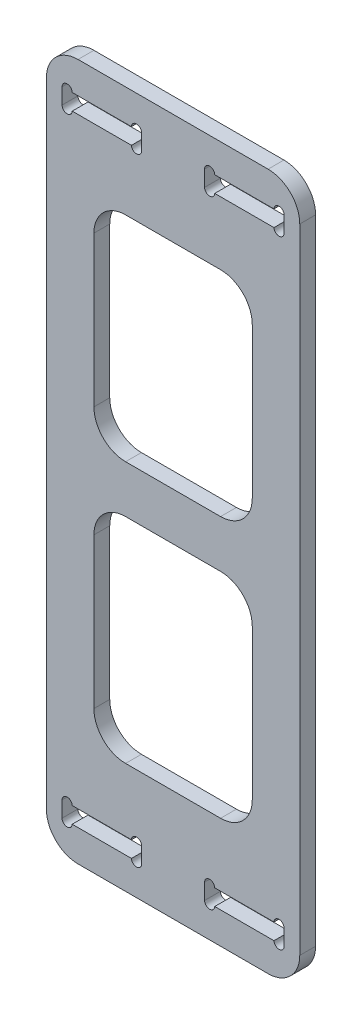
from build123d import *

# Parameters (mm, degrees)
SKETCH_1_W          = 25
SKETCH_1_H          = 5
SKETCH_1_W_2        = 70
SKETCH_1_H_2        = 190
EXTRUDE_1_DEPTH     = 5
SKETCH_3_W          = 50
SKETCH_3_H          = 67.5
CUT_EXTRUDE_2_DEPTH = 5
FILLET_1_R          = 10
CUT_EXTRUDE_3_DEPTH = 10
SKETCH_6_W          = 5
SKETCH_6_H          = 220
EXTRUDE_2_DEPTH     = 5
MOVE_FACE_1_DEPTH   = 5
FILLET_2_R          = 10


# Read off the part's stored shape, not the designer's step: 移动面1
with BuildPart() as part:
    # 草图1 → 凸台-拉伸1 (new body)
    with BuildSketch(Plane.XY):
        with Locations((57.5, 192.5)):
            Rectangle(SKETCH_1_W, SKETCH_1_H)
        with Locations((35, 95)):
            Rectangle(SKETCH_1_W_2, SKETCH_1_H_2)
        with Locations((12.5, 192.5)):
            Rectangle(SKETCH_1_W, SKETCH_1_H)
        with Locations((57.5, -2.5)):
            Rectangle(SKETCH_1_W, SKETCH_1_H)
        with Locations((12.5, -2.5)):
            Rectangle(SKETCH_1_W, SKETCH_1_H)
        Polygon((25, -5), (0, -5), (0, -15), (70, -15), (70, -5), (45, -5), (45, 0), (25, 0), align=None)
        Polygon((25, 195), (25, 190), (45, 190), (45, 195), (70, 195), (70, 205), (0, 205), (0, 195), align=None)
    extrude(amount=EXTRUDE_1_DEPTH)

    # 草图3 → 切除-拉伸2 (cut)
    with BuildSketch(Plane.XY.offset(5)):
        with Locations((35, 53.75)):
            Rectangle(SKETCH_3_W, SKETCH_3_H)
        with Locations((35, 136.25)):
            Rectangle(SKETCH_3_W, SKETCH_3_H)
    extrude(amount=-CUT_EXTRUDE_2_DEPTH, mode=Mode.SUBTRACT)

    # 圆角1
    fillet_1_edges = [part.edges().sort_by_distance(p)[0] for p in [
        (10, 20, 2.5),
        (10, 87.5, 2.5),
        (60, 87.5, 2.5),
        (60, 20, 2.5),
        (10, 102.5, 2.5),
        (10, 170, 2.5),
        (60, 170, 2.5),
        (60, 102.5, 2.5),
    ]]
    fillet(fillet_1_edges, radius=FILLET_1_R)

    # 草图5 → 切除-拉伸3 (cut)
    with BuildSketch(Plane.XY.offset(5)):
        with BuildLine():
            Line((3.1, 0), (21.9, 0))
            ThreePointArc((21.9, 0), (23.45, 1.55), (25, 0))
            Line((25, 0), (25, -5))
            ThreePointArc((25, -5), (23.45, -6.55), (21.9, -5))
            Line((21.9, -5), (3.1, -5))
            ThreePointArc((3.1, -5), (1.55, -6.55), (0, -5))
            Line((0, -5), (0, 0))
            ThreePointArc((0, 0), (1.55, 1.55), (3.1, 0))
        make_face()
        with BuildLine():
            Line((45, 0), (45, -5))
            ThreePointArc((45, -5), (46.55, -6.55), (48.1, -5))
            Line((48.1, -5), (66.9, -5))
            ThreePointArc((66.9, -5), (68.45, -6.55), (70, -5))
            Line((70, -5), (70, 0))
            ThreePointArc((70, 0), (68.45, 1.55), (66.9, 0))
            Line((66.9, 0), (48.1, 0))
            ThreePointArc((48.1, 0), (46.55, 1.55), (45, 0))
        make_face()
        with BuildLine():
            Line((66.9, 190), (48.1, 190))
            ThreePointArc((48.1, 190), (46.55, 188.45), (45, 190))
            Line((45, 190), (45, 195))
            ThreePointArc((45, 195), (46.55, 196.55), (48.1, 195))
            Line((48.1, 195), (66.9, 195))
            ThreePointArc((66.9, 195), (68.45, 196.55), (70, 195))
            Line((70, 195), (70, 190))
            ThreePointArc((70, 190), (68.45, 188.45), (66.9, 190))
        make_face()
        with BuildLine():
            Line((25, 190), (25, 195))
            ThreePointArc((25, 195), (23.45, 196.55), (21.9, 195))
            Line((21.9, 195), (3.1, 195))
            ThreePointArc((3.1, 195), (1.55, 196.55), (0, 195))
            Line((0, 195), (0, 190))
            ThreePointArc((0, 190), (1.55, 188.45), (3.1, 190))
            Line((3.1, 190), (21.9, 190))
            ThreePointArc((21.9, 190), (23.45, 188.45), (25, 190))
        make_face()
    extrude(amount=-CUT_EXTRUDE_3_DEPTH, mode=Mode.SUBTRACT)

    # 草图6 → 凸台-拉伸2 (add)
    with BuildSketch(Plane.XY.offset(5)):
        with Locations((72.5, 95)):
            Rectangle(SKETCH_6_W, SKETCH_6_H)
        with Locations((-2.5, 95)):
            Rectangle(SKETCH_6_W, SKETCH_6_H)
    extrude(amount=-EXTRUDE_2_DEPTH)

    # Move Face 1 outline → Move Face 1 (cut)
    # profile 1 of 4: a face of its own
    with BuildSketch(Plane.XY):
        with BuildLine():
            Line((21.850781441, 0.05), (3.149218559, 0.05))
            ThreePointArc((3.149218559, 0.05), (1.524996947, 1.599804628), (-0.05, 0))
            Line((-0.05, 0), (-0.05, -5))
            ThreePointArc((-0.05, -5), (1.524996947, -6.599804628), (3.149218559, -5.05))
            Line((3.149218559, -5.05), (21.850781441, -5.05))
            ThreePointArc((21.850781441, -5.05), (23.475003053, -6.599804628), (25.05, -5))
            Line((25.05, -5), (25.05, 0))
            ThreePointArc((25.05, 0), (23.475003053, 1.599804628), (21.850781441, 0.05))
        make_face()
        with BuildLine():
            ThreePointArc((0, 0), (1.55, 1.55), (3.1, 0))
            Line((3.1, 0), (21.9, 0))
            ThreePointArc((21.9, 0), (23.45, 1.55), (25, 0))
            Line((25, 0), (25, -5))
            ThreePointArc((25, -5), (23.45, -6.55), (21.9, -5))
            Line((21.9, -5), (3.1, -5))
            ThreePointArc((3.1, -5), (1.55, -6.55), (0, -5))
            Line((0, -5), (0, 0))
        make_face(mode=Mode.SUBTRACT)
    # profile 2 of 4: a face of its own
    with BuildSketch(Plane.XY):
        with BuildLine():
            ThreePointArc((70.05, 0), (68.475003053, 1.599804628), (66.850781441, 0.05))
            Line((66.850781441, 0.05), (48.149218559, 0.05))
            ThreePointArc((48.149218559, 0.05), (46.524996947, 1.599804628), (44.95, 0))
            Line((44.95, 0), (44.95, -5))
            ThreePointArc((44.95, -5), (46.524996947, -6.599804628), (48.149218559, -5.05))
            Line((48.149218559, -5.05), (66.850781441, -5.05))
            ThreePointArc((66.850781441, -5.05), (68.475003053, -6.599804628), (70.05, -5))
            Line((70.05, -5), (70.05, 0))
        make_face()
        with BuildLine():
            Line((48.1, 0), (66.9, 0))
            ThreePointArc((66.9, 0), (68.45, 1.55), (70, 0))
            Line((70, 0), (70, -5))
            ThreePointArc((70, -5), (68.45, -6.55), (66.9, -5))
            Line((66.9, -5), (48.1, -5))
            ThreePointArc((48.1, -5), (46.55, -6.55), (45, -5))
            Line((45, -5), (45, 0))
            ThreePointArc((45, 0), (46.55, 1.55), (48.1, 0))
        make_face(mode=Mode.SUBTRACT)
    # profile 3 of 4: a face of its own
    with BuildSketch(Plane.XY):
        with BuildLine():
            ThreePointArc((21.850781441, 189.95), (23.475003053, 188.400195372), (25.05, 190))
            Line((25.05, 190), (25.05, 195))
            ThreePointArc((25.05, 195), (23.475003053, 196.599804628), (21.850781441, 195.05))
            Line((21.850781441, 195.05), (3.149218559, 195.05))
            ThreePointArc((3.149218559, 195.05), (1.524996947, 196.599804628), (-0.05, 195))
            Line((-0.05, 195), (-0.05, 190))
            ThreePointArc((-0.05, 190), (1.524996947, 188.400195372), (3.149218559, 189.95))
            Line((3.149218559, 189.95), (21.850781441, 189.95))
        make_face()
        with BuildLine():
            Line((25, 195), (25, 190))
            ThreePointArc((25, 190), (23.45, 188.45), (21.9, 190))
            Line((21.9, 190), (3.1, 190))
            ThreePointArc((3.1, 190), (1.55, 188.45), (0, 190))
            Line((0, 190), (0, 195))
            ThreePointArc((0, 195), (1.55, 196.55), (3.1, 195))
            Line((3.1, 195), (21.9, 195))
            ThreePointArc((21.9, 195), (23.45, 196.55), (25, 195))
        make_face(mode=Mode.SUBTRACT)
    # profile 4 of 4: a face of its own
    with BuildSketch(Plane.XY):
        with BuildLine():
            ThreePointArc((48.149218559, 195.05), (46.524996947, 196.599804628), (44.95, 195))
            Line((44.95, 195), (44.95, 190))
            ThreePointArc((44.95, 190), (46.524996947, 188.400195372), (48.149218559, 189.95))
            Line((48.149218559, 189.95), (66.850781441, 189.95))
            ThreePointArc((66.850781441, 189.95), (68.475003053, 188.400195372), (70.05, 190))
            Line((70.05, 190), (70.05, 195))
            ThreePointArc((70.05, 195), (68.475003053, 196.599804628), (66.850781441, 195.05))
            Line((66.850781441, 195.05), (48.149218559, 195.05))
        make_face()
        with BuildLine():
            Line((45, 190), (45, 195))
            ThreePointArc((45, 195), (46.55, 196.55), (48.1, 195))
            Line((48.1, 195), (66.9, 195))
            ThreePointArc((66.9, 195), (68.45, 196.55), (70, 195))
            Line((70, 195), (70, 190))
            ThreePointArc((70, 190), (68.45, 188.45), (66.9, 190))
            Line((66.9, 190), (48.1, 190))
            ThreePointArc((48.1, 190), (46.55, 188.45), (45, 190))
        make_face(mode=Mode.SUBTRACT)
    extrude(amount=MOVE_FACE_1_DEPTH, mode=Mode.SUBTRACT)

    # 圆角2
    fillet_2_edges = [part.edges().sort_by_distance(p)[0] for p in [
        (75, 205, 2.5),
        (75, -15, 2.5),
        (-5, -15, 2.5),
        (-5, 205, 2.5),
    ]]
    fillet(fillet_2_edges, radius=FILLET_2_R)


solid = part.part
